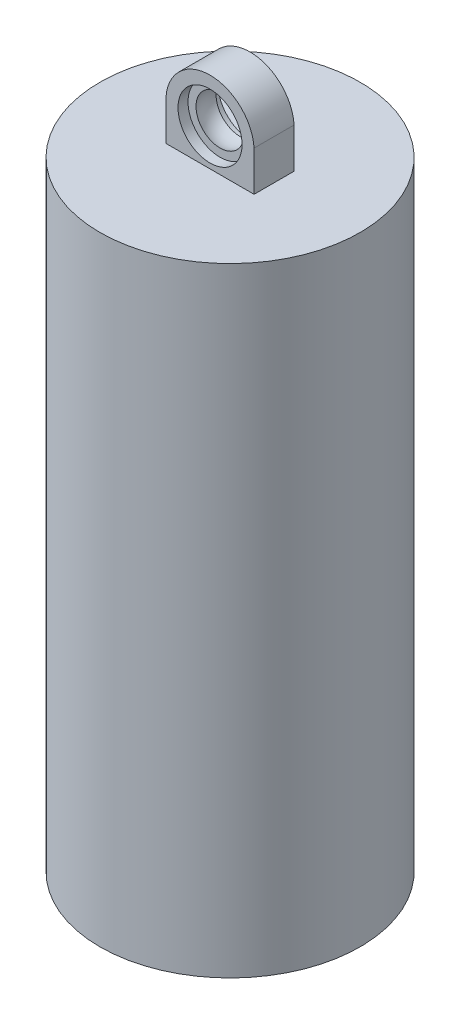
from build123d import *

# Parameters (mm, degrees)
SKETCH_1_R          = 32.5
EXTRUDE_1_DEPTH     = 154.5
SKETCH_2_R          = 12.5
EXTRUDE_2_DEPTH     = 6
SKETCH_3_R          = 6
CUT_EXTRUDE_1_DEPTH = 80
SKETCH_4_R          = 8
EXTRUDE_3_DEPTH     = 5
SKETCH_5_R          = 8
EXTRUDE_4_DEPTH     = 2.5
SKETCH_8_R          = 4
SKETCH_7_R          = 6
SKETCH_9_R          = 2.5
CUT_EXTRUDE_2_DEPTH = 31
SKETCH_10_R         = 6
CUT_EXTRUDE_3_DEPTH = 17


with BuildPart() as part:
    # 草图1 → 凸台-拉伸1 (new body)
    with BuildSketch(Plane(origin=(0, 0, 0), x_dir=(1, 0, 0), z_dir=(0, 1, 0))):
        Circle(SKETCH_1_R)
    extrude(amount=EXTRUDE_1_DEPTH)

    # 草图2 → 凸台-拉伸2 (add)
    with BuildSketch(Plane.XZ):
        Circle(SKETCH_2_R)
    extrude(amount=EXTRUDE_2_DEPTH)

    # 草图3 → 切除-拉伸1 (cut)
    with BuildSketch(Plane.XZ.offset(6)):
        Circle(SKETCH_3_R)
    extrude(amount=-CUT_EXTRUDE_1_DEPTH, mode=Mode.SUBTRACT)

    # 草图4 → 凸台-拉伸3 (add, symmetric)
    with BuildSketch(Plane.XY):
        with BuildLine():
            Line((-11, 154.5), (11, 154.5))
            Line((11, 154.5), (11, 164.5))
            ThreePointArc((11, 164.5), (0, 174.786108986), (-11, 164.5))
            Line((-11, 164.5), (-11, 154.5))
        make_face()
        with Locations((0, 163.761335751)):
            Circle(SKETCH_4_R, mode=Mode.SUBTRACT)
    extrude(amount=EXTRUDE_3_DEPTH, both=True)

    # 草图5 → 凸台-拉伸4 (add, symmetric)
    with BuildSketch(Plane.XY):
        with Locations((0, 163.761335751)):
            Circle(SKETCH_5_R)
    extrude(amount=EXTRUDE_4_DEPTH, both=True)

    # 草图8 → 放样1 section 0
    with BuildSketch(Plane.XY.offset(4.5)):
        with Locations((0, 163.761335751)):
            Circle(SKETCH_8_R)
    # 草图7 → 放样1 section 1
    with BuildSketch(Plane.XY.offset(2.5)):
        with Locations((0, 163.761335751)):
            Circle(SKETCH_7_R)
    loft_1 = loft()

    # 镜向1: 放样1 across plane
    add(loft_1.mirror(Plane.XY))

    # 草图9 → 切除-拉伸2 (cut)
    with BuildSketch(Plane.XY.offset(4.5)):
        with Locations((0, 166.761335751)):
            Circle(SKETCH_9_R)
    extrude(amount=-CUT_EXTRUDE_2_DEPTH, mode=Mode.SUBTRACT)

    # 草图10 → 切除-拉伸3 (cut)
    with BuildSketch(Plane.XY.offset(4.5)):
        with Locations((0, 163.761335751)):
            Circle(SKETCH_10_R)
    extrude(amount=-CUT_EXTRUDE_3_DEPTH, mode=Mode.SUBTRACT)

    # 草图11 → 切除-旋转1 (revolve, cut)
    with BuildSketch(Plane.XY):
        with BuildLine():
            Line((0, 170.261335751), (0, 157.261335751))
            ThreePointArc((0, 157.261335751), (6.5, 163.761335751), (0, 170.261335751))
        make_face()
    revolve(axis=Axis((0, 170.261335751, 0), (0, -1, 0)), mode=Mode.SUBTRACT)


solid = part.part
